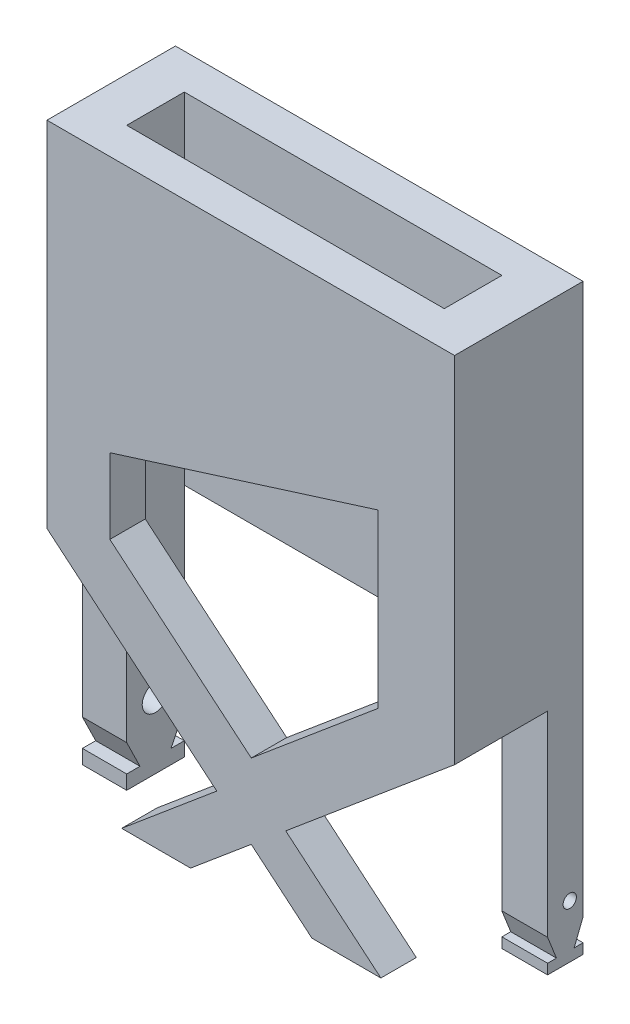
from build123d import *

# Parameters (mm, degrees)
BOSS_EXTRUDE1_DEPTH   = 0.8
SKETCH5_W             = 1
SKETCH5_H             = 13
SKETCH5_W_2           = 1.031823626
SKETCH5_H_2           = 8
BOSS_EXTRUDE2_DEPTH   = 1.3
BOSS_EXTRUDE3_DEPTH   = 0.8
M3_TAPPED_HOLE1_D     = 2.5
M3_TAPPED_HOLE1_DEPTH = 0.8
THREAD2_PITCH         = 0.5
CUT_EXTRUDE1_REACH    = 17.709
SKETCH12_R            = 0.3
CUT_EXTRUDE2_REACH    = 19.895
CUT_EXTRUDE3_REACH    = 17.709
SKETCH14_R            = 0.15


with BuildPart() as part:
    # Sketch1 → Boss-Extrude1 (new body)
    with BuildSketch(Plane.XY):
        Polygon((3.214446547, 12.558271664), (12.414446547, 12.558271664), (12.414446547, 4.558271664), (8.603545102, 1.360545667), (10.75141162, -0.441728336), (9.195687793, -0.441728336), (7.825683188, 0.707842022), (6.455678584, -0.441728336), (4.899954757, -0.441728336), (7.047821275, 1.360545667), (3.214446547, 4.577128987), align=None)
    extrude(amount=BOSS_EXTRUDE1_DEPTH)

    # Sketch5 → Boss-Extrude2 (add)
    with BuildSketch(Plane(origin=(0, 0, 0), x_dir=(-1, 0, 0), z_dir=(0, 0, -1))):
        with Locations((-3.714446547, 6.058271664)):
            Rectangle(SKETCH5_W, SKETCH5_H)
        with Locations((-11.898534734, 8.558271664)):
            Rectangle(SKETCH5_W_2, SKETCH5_H_2)
    extrude(amount=BOSS_EXTRUDE2_DEPTH)

    # Sketch8 → Boss-Extrude3 (add)
    with BuildSketch(Plane(origin=(0, 0, -1.3), x_dir=(-1, 0, 0), z_dir=(0, 0, -1))):
        Polygon((-12.414446547, 12.558271664), (-3.214446547, 12.558271664), (-3.214446547, 4.872903055), (-11.382622921, 4.872903055), (-11.382622921, -0.60025791), (-12.414446547, -0.60025791), align=None)
    extrude(amount=BOSS_EXTRUDE3_DEPTH)

    # M3 Tapped Hole1
    with Locations(Plane(origin=(0, 0, -1.3), x_dir=(-1, 0, 0), z_dir=(0, 0, 1))):
        with Locations((-7.814446547, -8.649654686)):
            Hole(M3_TAPPED_HOLE1_D / 2, depth=M3_TAPPED_HOLE1_DEPTH)

    # Thread2: the profile of Thread Profile4 profile screwed along a right-hand helix of 1.6 turns, 6 arcs to a turn; built about Z, then put on its axis
    thread2_z = Axis((0, 0, 0), (0, 0, 1))
    thread2_corners = [(1.2497, 0, -0.000173205), (1.520632937, 0, 0.156249999), (1.520632937, 0, 0.218749999), (1.2497, 0, 0.375173204)]
    with BuildLine(mode=Mode.PRIVATE) as thread2_profile:
        Line(thread2_corners[0], thread2_corners[1])
        Line(thread2_corners[1], thread2_corners[2])
        Line(thread2_corners[2], thread2_corners[3])
        Line(thread2_corners[3], thread2_corners[0])
    thread2_cap = Face(thread2_profile.wire())
    thread2_turn_angles = [0, 30, 60, 90, 120, 150, 180, 210, 240, 270, 300, 330, 360]
    thread2_turn_weights = [1, 0.8660254037844387, 1, 0.8660254037844387, 1, 0.8660254037844387, 1, 0.8660254037844387, 1, 0.8660254037844387, 1, 0.8660254037844387, 1]
    thread2_turn_rails = [Edge.make_bspline([Vector(p[0], p[1], 0).rotate(thread2_z, thread2_turn_angles[k]) / thread2_turn_weights[k] + Vector(0, 0, p[2] + THREAD2_PITCH * thread2_turn_angles[k] / 360) for k in range(13)], [0, 0, 0, 1, 1, 2, 2, 3, 3, 4, 4, 5, 5, 6, 6, 6], 2, thread2_turn_weights) for p in thread2_corners]
    thread2_turn_sides = [Face.make_surface_from_curves(thread2_turn_rails[p[0]], thread2_turn_rails[p[1]]) for p in [(0, 1), (1, 2), (2, 3), (3, 0)]]
    thread2_last_angles = [360, 390, 420, 450, 480, 510, 540, 558, 576]
    thread2_last_weights = [1, 0.8660254037844387, 1, 0.8660254037844387, 1, 0.8660254037844387, 1, 0.9510565162951535, 1]
    thread2_last_rails = [Edge.make_bspline([Vector(p[0], p[1], 0).rotate(thread2_z, thread2_last_angles[k]) / thread2_last_weights[k] + Vector(0, 0, p[2] + THREAD2_PITCH * thread2_last_angles[k] / 360) for k in range(9)], [0, 0, 0, 1, 1, 2, 2, 3, 3, 4, 4, 4], 2, thread2_last_weights) for p in thread2_corners]
    thread2_last_sides = [Face.make_surface_from_curves(thread2_last_rails[p[0]], thread2_last_rails[p[1]]) for p in [(0, 1), (1, 2), (2, 3), (3, 0)]]
    thread2 = Plane(origin=(7.814446547, 8.649654686, -2.1), x_dir=(1, 0, 0), z_dir=(0, 0, 1)) * Solid(Shell([*thread2_turn_sides, *thread2_last_sides, thread2_cap, thread2_cap.rotate(thread2_z, 576).moved(Location((0, 0, THREAD2_PITCH * 576 / 360)))]))
    add(thread2, mode=Mode.SUBTRACT)

    # Sketch12 → Cut-Extrude1 (cut, up to next)
    with BuildSketch(Plane.ZY.offset(-3.214446547), mode=Mode.PRIVATE) as cut_extrude1_sk1:
        with Locations(Location((-0.65, 1.055227185, 0), (0, 0, 270))):
            Circle(SKETCH12_R)
    cut_extrude1_tool1 = extrude(cut_extrude1_sk1.sketch, amount=-CUT_EXTRUDE1_REACH, mode=Mode.PRIVATE) & part.part
    # Sketch12 → Cut-Extrude1 (cut, up to next)
    with BuildSketch(Plane.ZY.offset(-3.214446547), mode=Mode.PRIVATE) as cut_extrude1_sk2:
        Polygon((-1.3, 0.491189657), (-1, -0.121721645), (-1.3, -0.121721645), align=None)
    cut_extrude1_tool2 = extrude(cut_extrude1_sk2.sketch, amount=-CUT_EXTRUDE1_REACH, mode=Mode.PRIVATE) & part.part
    # Sketch12 → Cut-Extrude1 (cut, up to next)
    with BuildSketch(Plane.ZY.offset(-3.214446547), mode=Mode.PRIVATE) as cut_extrude1_sk3:
        Polygon((0, 0.491189657), (-0.3, -0.121721645), (0, -0.121721645), align=None)
    cut_extrude1_tool3 = extrude(cut_extrude1_sk3.sketch, amount=-CUT_EXTRUDE1_REACH, mode=Mode.PRIVATE) & part.part
    add(cut_extrude1_tool1.solids().sort_by_distance((3.214447, 1.055227, -0.65))[0], mode=Mode.SUBTRACT)
    add(cut_extrude1_tool2.solids().sort_by_distance((3.214447, 0.082582, -1.2))[0], mode=Mode.SUBTRACT)
    add(cut_extrude1_tool3.solids().sort_by_distance((3.214447, 0.082582, -0.1))[0], mode=Mode.SUBTRACT)

    # Sketch13 → Cut-Extrude2 (cut, up to next)
    with BuildSketch(Plane.XY.offset(0.8), mode=Mode.PRIVATE) as cut_extrude2_sk1:
        Polygon((4.634176401, 6.767991384), (4.634176401, 5.073282991), (7.825683188, 2.395290823), (10.687148853, 4.796345607), (10.687148853, 8.674644795), align=None)
    cut_extrude2_tool1 = extrude(cut_extrude2_sk1.sketch, amount=-CUT_EXTRUDE2_REACH, mode=Mode.PRIVATE) & part.part
    add(cut_extrude2_tool1.solids().sort_by_distance((7.949639, 5.66496, 0.8))[0], mode=Mode.SUBTRACT)

    # Sketch14 → Cut-Extrude3 (cut, up to next)
    with BuildSketch(Plane(origin=(12.414446547, 0, 0), x_dir=(0, 0, -1), z_dir=(1, 0, 0)), mode=Mode.PRIVATE) as cut_extrude3_sk1:
        with Locations(Location((1.8, 0.598886989, 0), (0, 0, 90))):
            Circle(SKETCH14_R)
    cut_extrude3_tool1 = extrude(cut_extrude3_sk1.sketch, amount=-CUT_EXTRUDE3_REACH, mode=Mode.PRIVATE) & part.part
    # Sketch14 → Cut-Extrude3 (cut, up to next)
    with BuildSketch(Plane(origin=(12.414446547, 0, 0), x_dir=(0, 0, -1), z_dir=(1, 0, 0)), mode=Mode.PRIVATE) as cut_extrude3_sk2:
        Polygon((1.3, 0.13596653), (1.5, -0.371538896), (1.3, -0.371538896), align=None)
    cut_extrude3_tool2 = extrude(cut_extrude3_sk2.sketch, amount=-CUT_EXTRUDE3_REACH, mode=Mode.PRIVATE) & part.part
    # Sketch14 → Cut-Extrude3 (cut, up to next)
    with BuildSketch(Plane(origin=(12.414446547, 0, 0), x_dir=(0, 0, -1), z_dir=(1, 0, 0)), mode=Mode.PRIVATE) as cut_extrude3_sk3:
        Polygon((2.1, 0.13596653), (1.9, -0.371538896), (2.1, -0.371538896), align=None)
    cut_extrude3_tool3 = extrude(cut_extrude3_sk3.sketch, amount=-CUT_EXTRUDE3_REACH, mode=Mode.PRIVATE) & part.part
    add(cut_extrude3_tool1.solids().sort_by_distance((12.414447, 0.598887, -1.8))[0], mode=Mode.SUBTRACT)
    add(cut_extrude3_tool2.solids().sort_by_distance((12.414447, -0.20237, -1.366667))[0], mode=Mode.SUBTRACT)
    add(cut_extrude3_tool3.solids().sort_by_distance((12.414447, -0.20237, -2.033333))[0], mode=Mode.SUBTRACT)


solid = part.part
